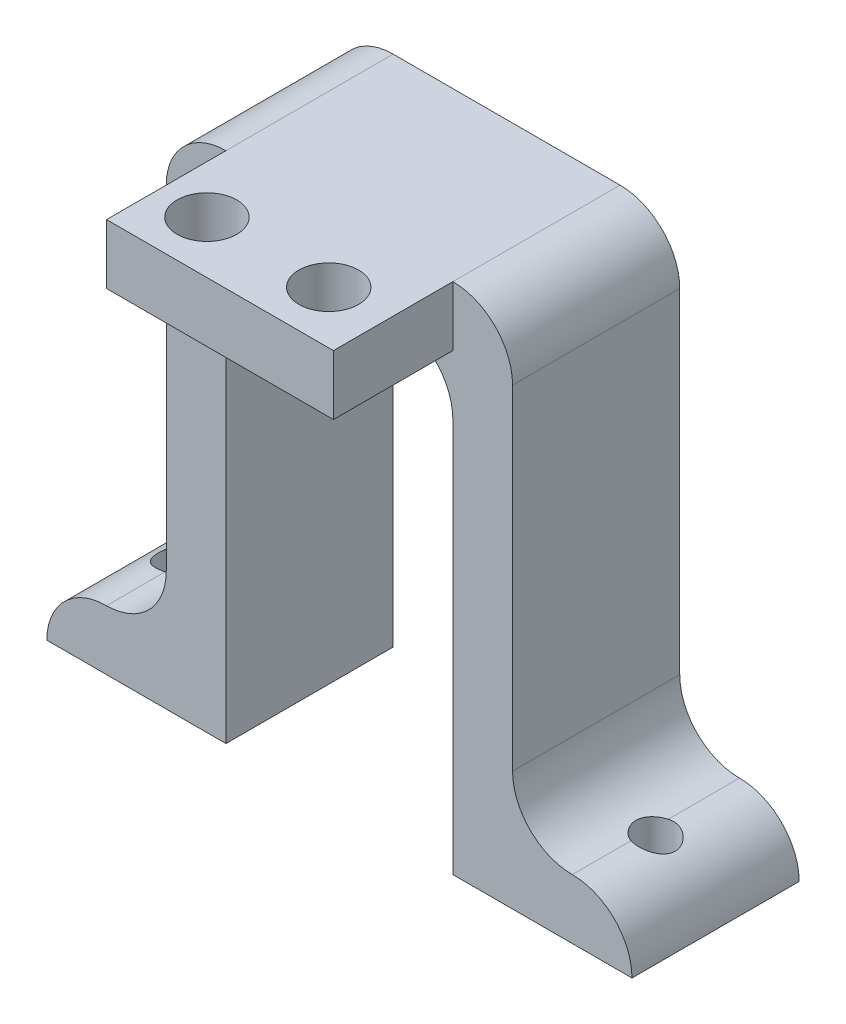
from build123d import *

# Parameters (mm, degrees)
BOSS_EXTRUDE1_DEPTH     = 14
FILLET1_R               = 5
FILLET2_R               = 5
CUT_EXTRUDE3_DEPTH      = 10
CUT_EXTRUDE3_DEPTH_BACK = 10
SKETCH2_R               = 1.636049027
SKETCH4_W               = 19
SKETCH4_H               = 5
BOSS_EXTRUDE2_DEPTH     = 10
SKETCH5_R               = 2.5
CUT_EXTRUDE4_DEPTH      = 10


with BuildPart() as part:
    # Sketch1 → Boss-Extrude1 (new body)
    with BuildSketch(Plane.XY):
        Polygon((-24.5, 0), (-24.5, 5), (-14.5, 5), (-14.5, 43), (14.5, 43), (14.5, 5), (24.5, 5), (24.5, 0), (9.5, 0), (9.5, 38), (-9.5, 38), (-9.5, 0), align=None)
    extrude(amount=BOSS_EXTRUDE1_DEPTH)

    # Fillet1
    fillet1_edges = [part.edges().sort_by_distance(p)[0] for p in [
        (-14.5, 43, 7),
        (14.5, 43, 7),
        (24.5, 5, 7),
        (-24.5, 5, 7),
        (14.5, 5, 7),
        (-14.5, 5, 7),
    ]]
    fillet(fillet1_edges, radius=FILLET1_R - 0.0001)  # a hair under: the kernel refuses the full size

    # Fillet2
    fillet2_edges = [part.edges().sort_by_distance(p)[0] for p in [
        (9.5, 38, 7),
        (-9.5, 38, 7),
    ]]
    fillet(fillet2_edges, radius=FILLET2_R)

    # Sketch2 → Cut-Extrude3 (cut, two sides: drawn at the far end of the back side and taken through both)
    with BuildSketch(Plane(origin=(0, 0, 0), x_dir=(1, 0, 0), z_dir=(0, 1, 0)).offset(-CUT_EXTRUDE3_DEPTH_BACK)):
        with Locations(Location((-20, -7.523321805, 0), (0, 0, 72.20487372))):
            Circle(SKETCH2_R)
        with Locations(Location((20, -7.523321805, 0), (0, 0, 107.795126278))):
            Circle(SKETCH2_R)
    extrude(amount=CUT_EXTRUDE3_DEPTH + CUT_EXTRUDE3_DEPTH_BACK, mode=Mode.SUBTRACT)

    # Sketch4 → Boss-Extrude2 (add)
    with BuildSketch(Plane.XY.offset(14)):
        with Locations((0, 40.5)):
            Rectangle(SKETCH4_W, SKETCH4_H)
    extrude(amount=BOSS_EXTRUDE2_DEPTH)

    # Sketch5 → Cut-Extrude4 (cut)
    with BuildSketch(Plane(origin=(0, 43, 0), x_dir=(1, 0, 0), z_dir=(0, 1, 0))):
        with Locations(Location((4.70575, -19.60149527, 0), (0, 0, 270))):
            Circle(SKETCH5_R)
        with Locations(Location((-5.477408827, -19.618067384, 0), (0, 0, 270))):
            Circle(SKETCH5_R)
    extrude(amount=-CUT_EXTRUDE4_DEPTH, mode=Mode.SUBTRACT)


solid = part.part
